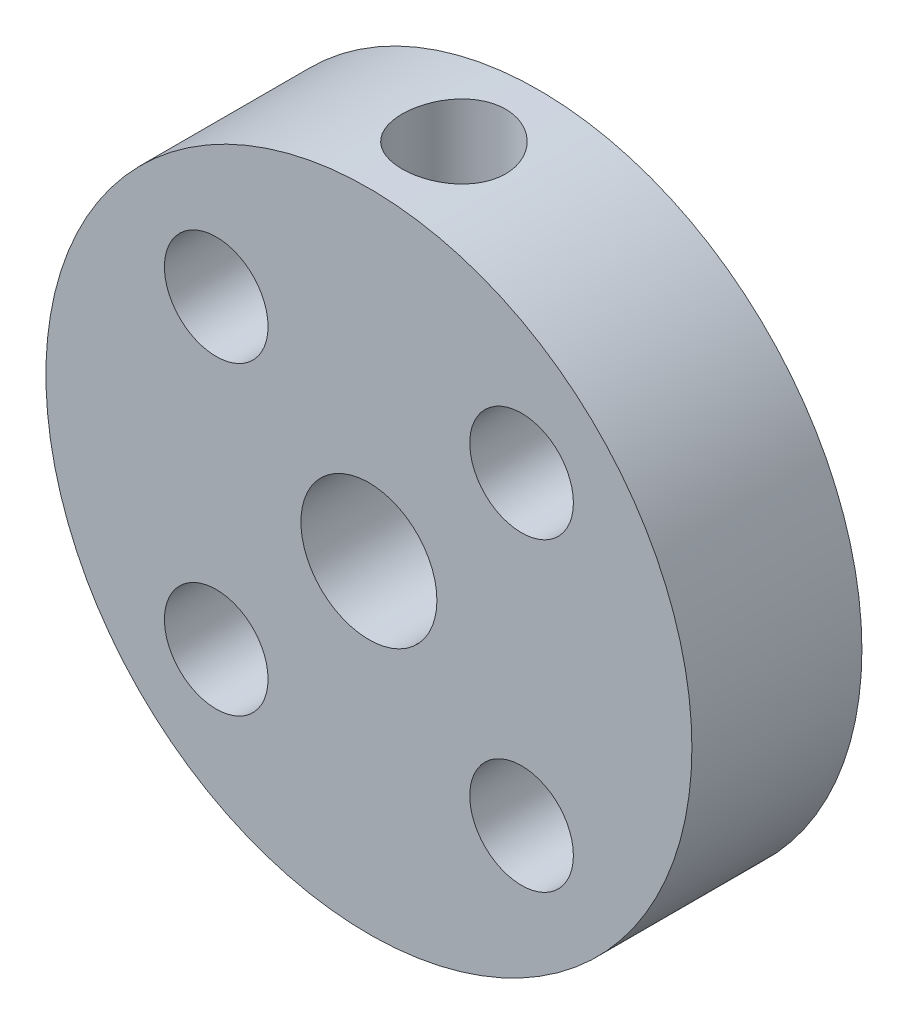
from build123d import *

# Parameters (mm, degrees)
SKETCH1_R                           = 9.5
SKETCH1_R_2                         = 1.524
SKETCH1_R_3                         = 2
BOSS_EXTRUDE1_DEPTH                 = 5
CUT_EXTRUDE1_REACH                  = 18.452
CUT_EXTRUDE1_END_RADIUS             = 2
SKETCH3_R                           = 1.524
CUT_EXTRUDE1_DIRECTION_2_REACH      = 18.452
CUT_EXTRUDE1_DIRECTION_2_END_RADIUS = 9.5


with BuildPart() as part:
    # Sketch1 → Boss-Extrude1 (new body)
    with BuildSketch(Plane.XY):
        Circle(SKETCH1_R)
        with Locations((4.490128061, -4.490128061)):
            Circle(SKETCH1_R_2, mode=Mode.SUBTRACT)
        with Locations((-4.490128061, -4.490128061)):
            Circle(SKETCH1_R_2, mode=Mode.SUBTRACT)
        with Locations((-4.490128061, 4.490128061)):
            Circle(SKETCH1_R_2, mode=Mode.SUBTRACT)
        with Locations((4.490128061, 4.490128061)):
            Circle(SKETCH1_R_2, mode=Mode.SUBTRACT)
        Circle(SKETCH1_R_3, mode=Mode.SUBTRACT)
    extrude(amount=BOSS_EXTRUDE1_DEPTH)

    # Cut-Extrude1: up to this cylinder (the profile starts outside it)
    cut_extrude1_end = Plane(origin=(0, 0, 2.5), z_dir=(0, 0, -1)) * Cylinder(CUT_EXTRUDE1_END_RADIUS, 41.904, mode=Mode.PRIVATE)
    # Sketch3 → Cut-Extrude1 (cut, up to the surface)
    with BuildSketch(Plane(origin=(0, 2.966128061, 0), x_dir=(1, 0, 0), z_dir=(0, 1, 0)), mode=Mode.PRIVATE) as cut_extrude1_sk1:
        with Locations((0, -2.5)):
            Circle(SKETCH3_R)
    cut_extrude1_tool1 = extrude(cut_extrude1_sk1.sketch, amount=-CUT_EXTRUDE1_REACH, mode=Mode.PRIVATE) - cut_extrude1_end
    add(cut_extrude1_tool1.solids().sort_by_distance((0, 2.966128, 2.5))[0], mode=Mode.SUBTRACT)

    # Cut-Extrude1 direction 2: up to this cylinder (the profile starts inside it)
    cut_extrude1_direction_2_end = Plane(origin=(0, 0, 2.5), z_dir=(0, 0, -1)) * Cylinder(CUT_EXTRUDE1_DIRECTION_2_END_RADIUS, 56.904, mode=Mode.PRIVATE)
    # Sketch3 → Cut-Extrude1 direction 2 (cut, up to the surface)
    with BuildSketch(Plane(origin=(0, 2.966128061, 0), x_dir=(1, 0, 0), z_dir=(0, 1, 0)), mode=Mode.PRIVATE) as cut_extrude1_direction_2_sk1:
        with Locations((0, -2.5)):
            Circle(SKETCH3_R)
    cut_extrude1_direction_2_tool1 = extrude(cut_extrude1_direction_2_sk1.sketch, amount=CUT_EXTRUDE1_DIRECTION_2_REACH, mode=Mode.PRIVATE) & cut_extrude1_direction_2_end
    add(cut_extrude1_direction_2_tool1.solids().sort_by_distance((0, 2.966128, 2.5))[0], mode=Mode.SUBTRACT)


solid = part.part
